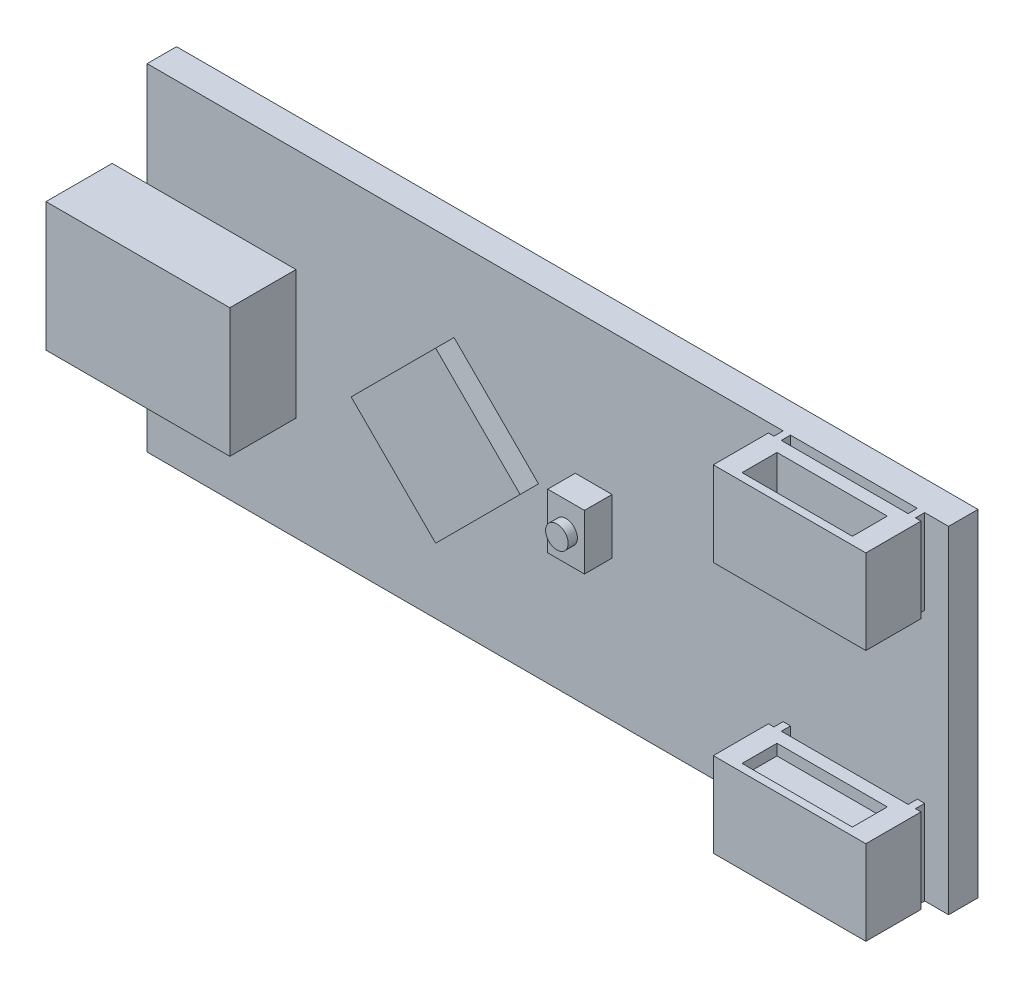
from build123d import *

# Parameters (mm, degrees)
SKETCH1_W               = 43.6
SKETCH1_H               = 18.3
BOSS_EXTRUDE1_DEPTH     = 1.6
USB_START               = 1.9
SKETCH2_W               = 3.6
SKETCH2_H               = 7
USB_CONNECTOR_DEPTH     = 10
MICROPROCESSOR_DEPTH    = 1
SKETCH4_W               = 2
SKETCH4_H               = 3
BUTTON_BASE_DEPTH       = 1.5
SKETCH5_R               = 0.613578093
BUTTON_DEPTH            = 0.5
SKETCH6_W               = 8.3
SKETCH6_H               = 3
SKETCH6_W_2             = 6
SKETCH6_H_2             = 1.9
SKETCH6_W_3             = 0.4
SKETCH6_H_3             = 0.5
JST_X_6_DEPTH           = 4.6
BOSS_EXTRUDE8_START     = -4
BOSS_EXTRUDE8_OUTLINE_W = 6
BOSS_EXTRUDE8_OUTLINE_H = 1.9
BOSS_EXTRUDE8_DEPTH     = 0.8


# Read off the part's stored shape, not the designer's step: Boss-Extrude8
with BuildPart() as part:
    # Sketch1 → Boss-Extrude1 (new body)
    with BuildSketch(Plane.XY):
        Rectangle(SKETCH1_W, SKETCH1_H)
    extrude(amount=BOSS_EXTRUDE1_DEPTH)

    # Sketch2 → USB Connector (add)
    with BuildSketch(Plane.ZY.offset(21.8).offset(USB_START)):
        with Locations((3.4, 0)):
            Rectangle(SKETCH2_W, SKETCH2_H)
    extrude(amount=-USB_CONNECTOR_DEPTH)

    # Sketch3 → MicroProcessor (add)
    with BuildSketch(Plane.XY.offset(1.6)):
        Polygon((-9.7, 0), (-5.103805922, 4.596194078), (-0.507611845, 0), (-5.103805922, -4.596194078), align=None)
    extrude(amount=MICROPROCESSOR_DEPTH)

    # Sketch4 → Button Base (add)
    with BuildSketch(Plane.XY.offset(1.6)):
        with Locations((2.492388155, 0)):
            Rectangle(SKETCH4_W, SKETCH4_H)
    extrude(amount=BUTTON_BASE_DEPTH)

    # Sketch5 → Button (add)
    with BuildSketch(Plane.XY.offset(3.1)):
        with Locations((2.492388155, 0)):
            Circle(SKETCH5_R)
    extrude(amount=BUTTON_DEPTH)


with BuildPart() as body_2:
    # Sketch6 → JST x 6 (new body)
    # profile 1 of 3: a face of its own
    with BuildSketch(Plane.XZ.offset(9.15)):
        with Locations((16.65, 3.6)):
            Rectangle(SKETCH6_W, SKETCH6_H)
        with Locations((16.65, 3.734337349)):
            Rectangle(SKETCH6_W_2, SKETCH6_H_2, mode=Mode.SUBTRACT)
    # profile 2 of 3: a face of its own
    with BuildSketch(Plane.XZ.offset(9.15)):
        with Locations((13, 1.85)):
            Rectangle(SKETCH6_W_3, SKETCH6_H_3)
    # profile 3 of 3: a face of its own
    with BuildSketch(Plane.XZ.offset(9.15)):
        with Locations((20.3, 1.85)):
            Rectangle(SKETCH6_W_3, SKETCH6_H_3)
    jst_x_6 = extrude(amount=-JST_X_6_DEPTH)

    # Boss-Extrude8 outline → Boss-Extrude8 (add)
    with BuildSketch(Plane.XZ.offset(9.15).offset(BOSS_EXTRUDE8_START)):
        with Locations((16.65, 3.734337349)):
            Rectangle(BOSS_EXTRUDE8_OUTLINE_W, BOSS_EXTRUDE8_OUTLINE_H)
    boss_extrude8 = extrude(amount=BOSS_EXTRUDE8_DEPTH)


with BuildPart() as part_1:
    add(part.part)

    # Mirror5: JST x 6, Boss-Extrude8 across plane
    add(jst_x_6.mirror(Plane.ZX))
    add(boss_extrude8.mirror(Plane.ZX))


solid = Compound([body_2.part, part_1.part])
